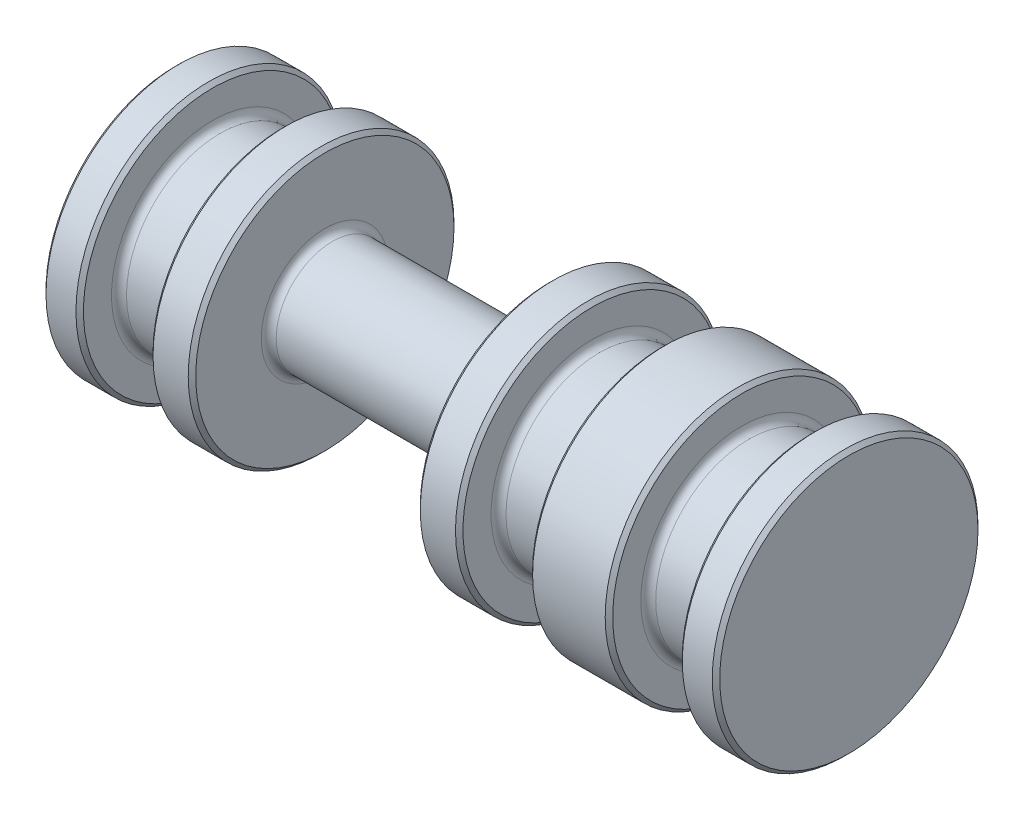
from build123d import *

# Parameters (mm, degrees)
SKETCH1_R           = 4.5085
BOSS_EXTRUDE1_DEPTH = 22.86
SKETCH2_W           = 2.3622
SKETCH2_H           = 1.3335
SKETCH2_W_2         = 7.62
SKETCH2_H_2         = 2.6035
FILLET1_R           = 0.254
CHAMFER1_SIZE       = 0.127
CHAMFER2_SIZE       = 0.127


with BuildPart() as part:
    # Sketch1 → Boss-Extrude1 (new body)
    with BuildSketch(Plane(origin=(0, 0, 0), x_dir=(0, 0, -1), z_dir=(1, 0, 0))):
        Circle(SKETCH1_R)
    extrude(amount=BOSS_EXTRUDE1_DEPTH)

    # Sketch2 → Cut-Revolve1 (revolve, cut)
    with BuildSketch(Plane.XY):
        with Locations((2.4511, 3.84175)):
            Rectangle(SKETCH2_W, SKETCH2_H)
        with Locations((20.4089, 3.84175)):
            Rectangle(SKETCH2_W, SKETCH2_H)
        with Locations((15.3289, 3.84175)):
            Rectangle(SKETCH2_W, SKETCH2_H)
        with Locations((8.89, 3.20675)):
            Rectangle(SKETCH2_W_2, SKETCH2_H_2)
    revolve(axis=Axis((-1.617419624, 0, 0), (1, 0, 0)), mode=Mode.SUBTRACT)

    # Fillet1
    fillet1_edges = [part.edges().sort_by_distance(p)[0] for p in [
        (21.59, -3.175, 0),
        (19.2278, -3.175, 0),
        (16.51, -3.175, 0),
        (14.1478, -3.175, 0),
        (12.7, -1.905, 0),
        (5.08, -1.905, 0),
        (3.6322, -3.175, 0),
        (1.27, -3.175, 0),
    ]]
    fillet(fillet1_edges, radius=FILLET1_R)

    # Chamfer1
    chamfer1_edges = [part.edges().sort_by_distance(p)[0] for p in [
        (12.7, 0, 4.5085),
        (0, 0, 4.5085),
        (21.59, 0, 4.5085),
        (16.51, 0, 4.5085),
        (3.6322, 0, 4.5085),
    ]]
    chamfer(chamfer1_edges, length=CHAMFER1_SIZE)

    # Chamfer2
    chamfer2_edges = [part.edges().sort_by_distance(p)[0] for p in [
        (22.86, 0, 4.5085),
        (19.2278, 0, 4.5085),
        (14.1478, 0, 4.5085),
        (5.08, 0, 4.5085),
        (1.27, 0, 4.5085),
    ]]
    chamfer(chamfer2_edges, length=CHAMFER2_SIZE)


solid = part.part
